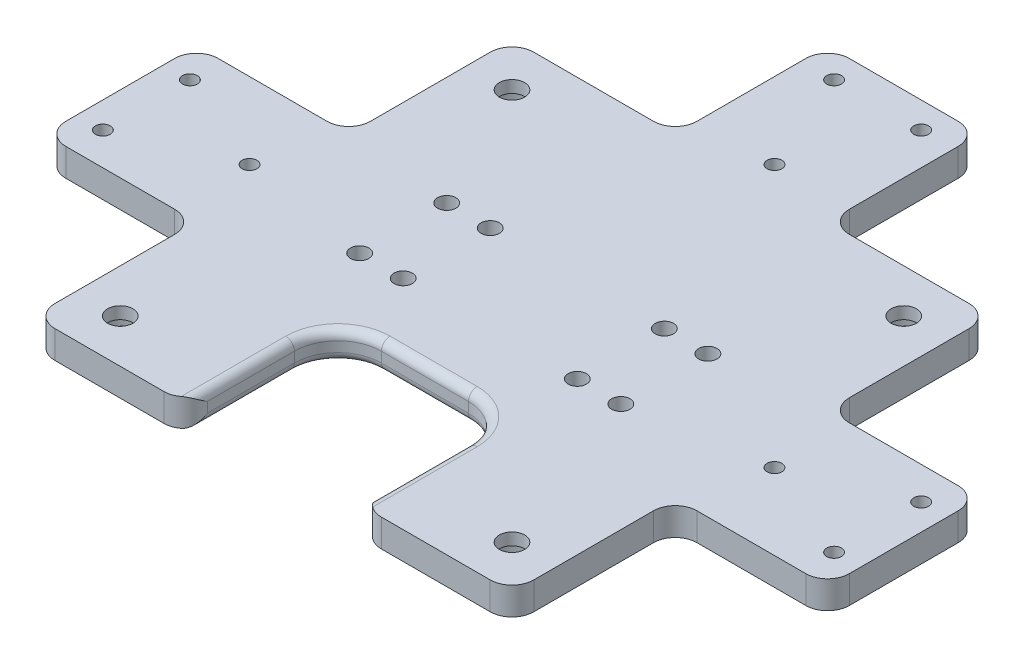
from build123d import *

# Parameters (mm, degrees)
BOSS_EXTRUDE1_DEPTH                     = 6.35
M5X0_8_TAPPED_HOLE1_D                   = 4.2
SKETCH4_W                               = 40
SKETCH4_H                               = 35
CUT_EXTRUDE1_DEPTH                      = 128.437523909
FILLET1_R                               = 5
CBORE_FOR_M5_HEX_HEAD_BOLT1_D           = 5.8
CBORE_FOR_M5_HEX_HEAD_BOLT1_CBORE_D     = 12.24
CBORE_FOR_M5_HEX_HEAD_BOLT1_CBORE_DEPTH = 3.58
FILLET2_R                               = 10
FILLET3_R                               = 2
CBORE_FOR_M3_SHCS1_D                    = 3.4
CBORE_FOR_M3_SHCS1_CBORE_D              = 6.5
CBORE_FOR_M3_SHCS1_CBORE_DEPTH          = 3


with BuildPart() as part:
    # Base plate → Boss-Extrude1 (new body)
    with BuildSketch(Plane(origin=(0, 0, 0), x_dir=(1, 0, 0), z_dir=(0, 1, 0))):
        Polygon((55, -55), (-55, -55), (-55, -17.5), (-90, -17.5), (-90, 17.5), (-55, 17.5), (-55, 55), (-17.5, 55), (-17.5, 90), (17.5, 90), (17.5, 55), (55, 55), (55, 17.5), (90, 17.5), (90, -17.5), (55, -17.5), align=None)
    extrude(amount=BOSS_EXTRUDE1_DEPTH)

    # M5x0.8 Tapped Hole1 (through all)
    with Locations(Plane(origin=(0, 0, 0), x_dir=(-1, 0, 0), z_dir=(0, -1, 0))):
        with Locations((-20, 15), (20, 15), (20, -5), (-20, -5), (-30, 15), (-30, -5), (30, 15), (30, -5)):
            Hole(M5X0_8_TAPPED_HOLE1_D / 2)

    # Sketch4 → Cut-Extrude1 (cut, through all)
    with BuildSketch(Plane(origin=(0, 6.35, 0), x_dir=(1, 0, 0), z_dir=(0, 1, 0))):
        with Locations((0, -37.5)):
            Rectangle(SKETCH4_W, SKETCH4_H)
    extrude(amount=-CUT_EXTRUDE1_DEPTH, mode=Mode.SUBTRACT)

    # Fillet1
    fillet1_edges = [part.edges().sort_by_distance(p)[0] for p in [
        (17.5, 3.175, -90),
        (17.5, 3.175, -55),
        (55, 3.175, -55),
        (55, 3.175, -17.5),
        (90, 3.175, -17.5),
        (90, 3.175, 17.5),
        (55, 3.175, 17.5),
        (55, 3.175, 55),
        (-55, 3.175, 55),
        (-55, 3.175, 17.5),
        (-90, 3.175, 17.5),
        (-90, 3.175, -17.5),
        (-55, 3.175, -17.5),
        (-55, 3.175, -55),
        (-17.5, 3.175, -55),
        (-17.5, 3.175, -90),
        (20, 3.175, 55),
        (-20, 3.175, 55),
    ]]
    fillet(fillet1_edges, radius=FILLET1_R)

    # CBORE for M5 Hex Head Bolt1 (through all)
    with Locations(Plane.XZ):
        with Locations((-45, 45), (-45, -45), (45, -45), (45, 45)):
            CounterBoreHole(CBORE_FOR_M5_HEX_HEAD_BOLT1_D / 2, CBORE_FOR_M5_HEX_HEAD_BOLT1_CBORE_D / 2, CBORE_FOR_M5_HEX_HEAD_BOLT1_CBORE_DEPTH)

    # Fillet2
    fillet2_edges = [part.edges().sort_by_distance(p)[0] for p in [
        (-20, 3.175, 20),
        (20, 3.175, 20),
    ]]
    fillet(fillet2_edges, radius=FILLET2_R)

    # Fillet3
    # the kernel refuses this fillet: 2 mm, written as the material it takes off along each edge
    with BuildSketch(Plane(origin=(20, 6.35, 30), x_dir=(0, -1, 0), z_dir=(0, 0, 1)), Plane(origin=(-20, 6.35, 55), x_dir=(0, -1, 0), z_dir=(0, 0, -1))) as fillet3_piece_1:
        with BuildLine():
            CenterArc((FILLET3_R, FILLET3_R), FILLET3_R, 180, 90)
            Line((0, FILLET3_R), (0, 0))
            Line((0, 0), (FILLET3_R, 0))
        make_face()
    extrude(amount=25, mode=Mode.SUBTRACT)
    with BuildSketch(Plane(origin=(-10, 6.35, 20), x_dir=(0, -1, 0), z_dir=(1, 0, 0))) as fillet3_piece_2:
        with BuildLine():
            CenterArc((FILLET3_R, FILLET3_R), FILLET3_R, 180, 90)
            Line((0, FILLET3_R), (0, 0))
            Line((0, 0), (FILLET3_R, 0))
        make_face()
    extrude(amount=20, mode=Mode.SUBTRACT)
    with BuildSketch(Plane(origin=(-20, 0, 30), x_dir=(-1, 0, 0), z_dir=(0, 0, 1)), Plane(origin=(20, 0, 55), x_dir=(1, 0, 0), z_dir=(0, 0, -1))) as fillet3_piece_3:
        with BuildLine():
            CenterArc((FILLET3_R, -FILLET3_R), FILLET3_R, 90, 90)
            Line((0, -FILLET3_R), (0, 0))
            Line((0, 0), (FILLET3_R, 0))
        make_face()
    extrude(amount=25, mode=Mode.SUBTRACT)
    with BuildSketch(Plane(origin=(10, 0, 20), x_dir=(0, 0, -1), z_dir=(-1, 0, 0))) as fillet3_piece_4:
        with BuildLine():
            CenterArc((FILLET3_R, -FILLET3_R), FILLET3_R, 90, 90)
            Line((0, -FILLET3_R), (0, 0))
            Line((0, 0), (FILLET3_R, 0))
        make_face()
    extrude(amount=20, mode=Mode.SUBTRACT)
    with BuildSketch(Plane(origin=(10, 0, 30), x_dir=(1, 0, 0), z_dir=(0, 0, 1))) as fillet3_piece_5:
        with BuildLine():
            CenterArc((10 + FILLET3_R, FILLET3_R), FILLET3_R, 180, 90)
            Line((10, FILLET3_R), (10, 0))
            Line((10, 0), (10 + FILLET3_R, 0))
        make_face()
    revolve(axis=Axis((10, 0, 30), (0, 1, 0)), revolution_arc=90, mode=Mode.SUBTRACT)
    with BuildSketch(Plane(origin=(-10, 0, 30), x_dir=(0, 0, -1), z_dir=(1, 0, 0))) as fillet3_piece_6:
        with BuildLine():
            CenterArc((10 + FILLET3_R, FILLET3_R), FILLET3_R, 180, 90)
            Line((10, FILLET3_R), (10, 0))
            Line((10, 0), (10 + FILLET3_R, 0))
        make_face()
    revolve(axis=Axis((-10, 0, 30), (0, 1, 0)), revolution_arc=90, mode=Mode.SUBTRACT)
    with BuildSketch(Plane(origin=(-10, 6.35, 30), x_dir=(0, 0, -1), z_dir=(1, 0, 0))) as fillet3_piece_7:
        with BuildLine():
            CenterArc((10 + FILLET3_R, -FILLET3_R), FILLET3_R, 90, 90)
            Line((10 + FILLET3_R, 0), (10, 0))
            Line((10, 0), (10, -FILLET3_R))
        make_face()
    revolve(axis=Axis((-10, 6.35, 30), (0, 1, 0)), revolution_arc=90, mode=Mode.SUBTRACT)
    with BuildSketch(Plane(origin=(10, 6.35, 30), x_dir=(1, 0, 0), z_dir=(0, 0, 1))) as fillet3_piece_8:
        with BuildLine():
            CenterArc((10 + FILLET3_R, -FILLET3_R), FILLET3_R, 90, 90)
            Line((10 + FILLET3_R, 0), (10, 0))
            Line((10, 0), (10, -FILLET3_R))
        make_face()
    revolve(axis=Axis((10, 6.35, 30), (0, 1, 0)), revolution_arc=90, mode=Mode.SUBTRACT)

    # CBORE for M3 SHCS1 (through all)
    with Locations(Plane(origin=(0, 0, 0), x_dir=(-1, 0, 0), z_dir=(0, -1, 0))):
        with Locations((10, 84), (-10, 84), (0, 60.3), (-84, 10), (-84, -10), (-60.3, 0), (84, -10), (84, 10), (60.3, 0)):
            CounterBoreHole(CBORE_FOR_M3_SHCS1_D / 2, CBORE_FOR_M3_SHCS1_CBORE_D / 2, CBORE_FOR_M3_SHCS1_CBORE_DEPTH)


solid = part.part
